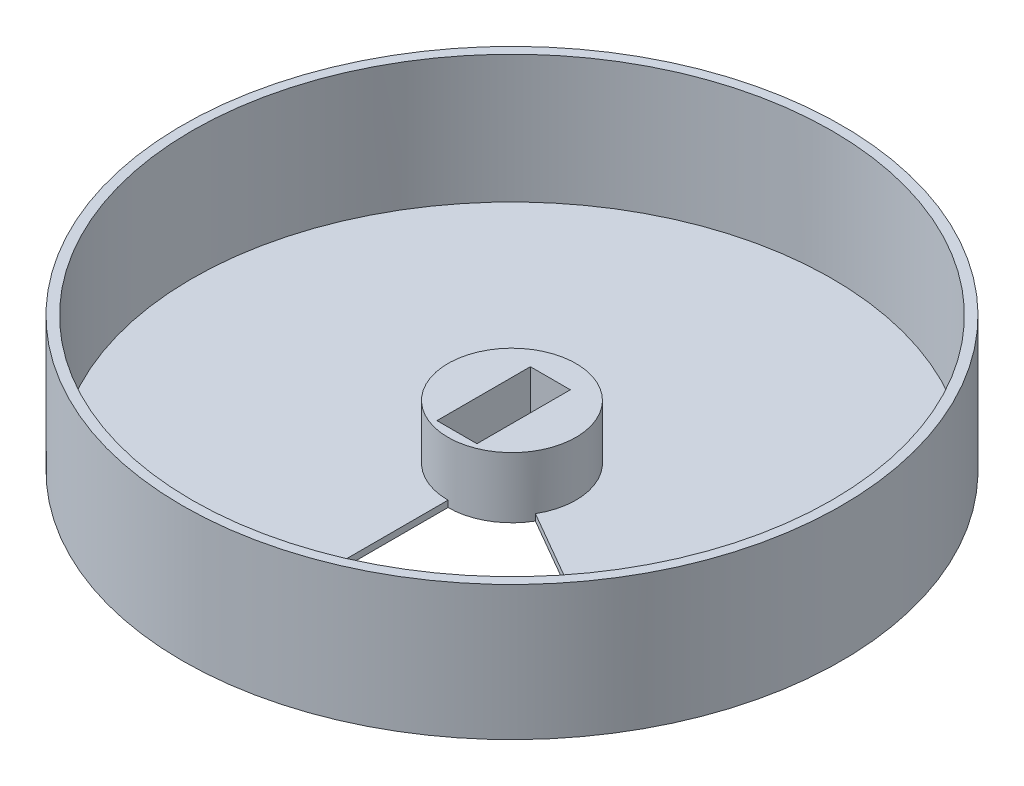
from build123d import *

# Parameters (mm, degrees)
SKETCH_1_R          = 20
SKETCH_1_W          = 12.5
SKETCH_1_H          = 29.2
EXTRUDE_1_DEPTH     = 17
SKETCH_1_4_R        = 103
SKETCH_1_4_R_2      = 100
EXTRUDE_2_DEPTH     = 40
SKETCH_3_R          = 103
EXTRUDE_4_DEPTH     = 2
CUT_EXTRUDE_START   = -2
CUT_EXTRUDE_2_DEPTH = 2


# Read off the part's stored shape, not the designer's step: 切除-拉伸2
with BuildPart() as part:
    # 草图1 → 凸台-拉伸1 (new body)
    with BuildSketch(Plane(origin=(0, 0, 0), x_dir=(1, 0, 0), z_dir=(0, 1, 0))):
        with Locations(Location((6.25, 17.2, 0), (0, 0, 270))):
            Circle(SKETCH_1_R)
        with Locations((6.25, 14.6)):
            Rectangle(SKETCH_1_W, SKETCH_1_H, mode=Mode.SUBTRACT)
    extrude(amount=EXTRUDE_1_DEPTH)



with BuildPart() as body_2:
    # 草图1<4> → 凸台-拉伸2 (new body)
    with BuildSketch(Plane(origin=(0, 0, 0), x_dir=(1, 0, 0), z_dir=(0, 1, 0))):
        with Locations(Location((6.25, 17.2, 0), (0, 0, 270))):
            Circle(SKETCH_1_4_R)
        with Locations(Location((6.25, 17.2, 0), (0, 0, 270))):
            Circle(SKETCH_1_4_R_2, mode=Mode.SUBTRACT)
    extrude(amount=EXTRUDE_2_DEPTH)


with BuildPart() as part_1:
    add(part.part)

    add(body_2.part)  # 凸台-拉伸4 merges body 2
    # 草图3 → 凸台-拉伸4 (add)
    with BuildSketch(Plane.XZ):
        with Locations(Location((6.25, -17.2, 0), (0, 0, 90))):
            Circle(SKETCH_3_R)
    extrude(amount=EXTRUDE_4_DEPTH)

    # 切除-拉伸2 outline → 切除-拉伸2 (cut)
    with BuildSketch(Plane(origin=(0, 0, 0), x_dir=(1, 0, 0), z_dir=(0, 1, 0)).offset(CUT_EXTRUDE_START)):
        with BuildLine():
            Line((92.852540378, -32.8), (23.570508076, 7.2))
            ThreePointArc((23.570508076, 7.2), (16.25, -0.120508076), (6.25, -2.8))
            Line((6.25, -2.8), (6.25, -82.8))
            ThreePointArc((6.25, -82.8), (56.25, -69.402540378), (92.852540378, -32.8))
        make_face()
    extrude(amount=CUT_EXTRUDE_2_DEPTH, mode=Mode.SUBTRACT)


solid = part_1.part
